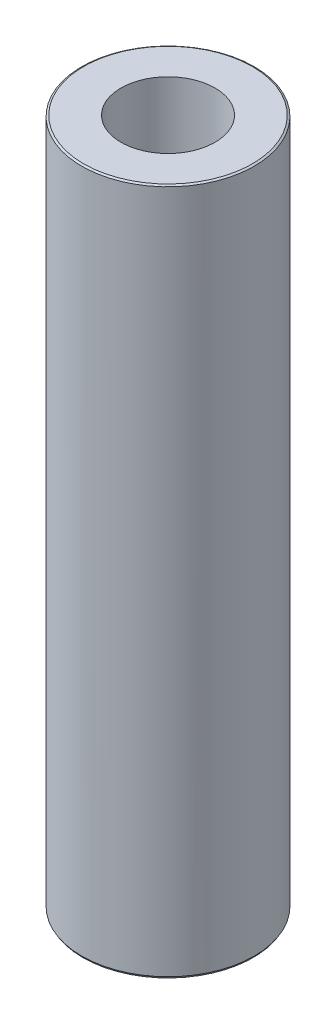
from build123d import *
from OCP.BRepFilletAPI import BRepFilletAPI_MakeChamfer

# Parameters (mm, degrees)
SKETCH1_R           = 45
BOSS_EXTRUDE1_DEPTH = 358.49204184
SKETCH2_R           = 24.548342448
CUT_EXTRUDE1_DEPTH  = 365.09688829
CHAMFER1_SIZE       = 0.571350199
CHAMFER1_SIZE2      = 0.989607573


with BuildPart() as part:
    # Sketch1 → Boss-Extrude1 (new body)
    with BuildSketch(Plane(origin=(0, 0, 0), x_dir=(1, 0, 0), z_dir=(0, 1, 0))):
        Circle(SKETCH1_R)
    extrude(amount=BOSS_EXTRUDE1_DEPTH)

    # Sketch2 → Cut-Extrude1 (cut, through all)
    with BuildSketch(Plane(origin=(0, 0, 0), x_dir=(1, 0, 0), z_dir=(0, 1, 0))):
        Circle(SKETCH2_R)
    extrude(amount=CUT_EXTRUDE1_DEPTH, mode=Mode.SUBTRACT)

    # Chamfer1: one chamfer whose edges measure the first distance from different faces: ONE call of the kernel's chamfer builder (chamfer() names one face for all edges)
    chamfer1_edges_1 = [part.edges().sort_by_distance(p)[0] for p in [
        (-45, 358.49204184, 0),
    ]]
    chamfer1_side_1 = [part.faces().sort_by_distance(p)[0] for p in [
        (-45, 179.24602092, 0),
    ]]
    chamfer1_edges_2 = [part.edges().sort_by_distance(p)[0] for p in [
        (-45, 0, 0),
    ]]
    chamfer1_side_2 = [part.faces().sort_by_distance(p)[0] for p in [
        (-43.727207794, 0, 0),
    ]]
    chamfer1 = BRepFilletAPI_MakeChamfer(part.part.solid().wrapped)
    for e in chamfer1_edges_1:
        chamfer1.Add(CHAMFER1_SIZE, CHAMFER1_SIZE2, e.wrapped, chamfer1_side_1[0].wrapped)  # the first distance lies on this face
    for e in chamfer1_edges_2:
        chamfer1.Add(CHAMFER1_SIZE, CHAMFER1_SIZE2, e.wrapped, chamfer1_side_2[0].wrapped)  # the first distance lies on this face
    add(Compound.cast(chamfer1.Shape()), mode=Mode.REPLACE)


solid = part.part
